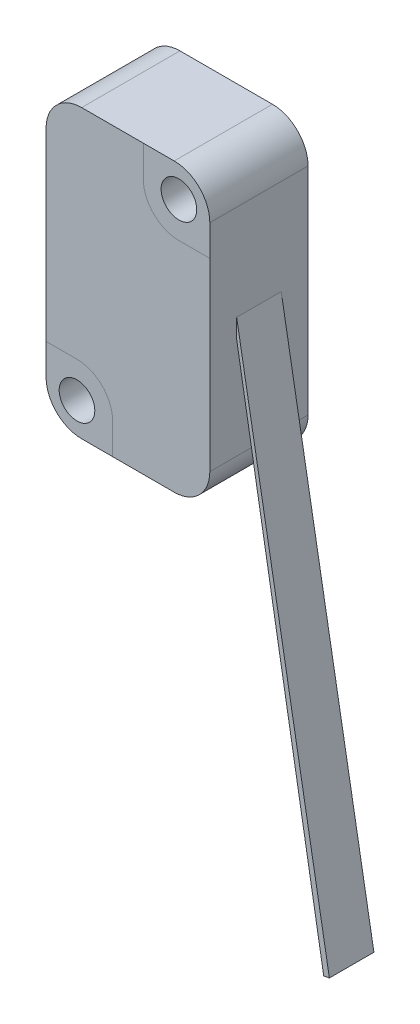
from build123d import *

# Parameters (mm, degrees)
SKETCH1_W                   = 15.875
SKETCH1_H                   = 27.813
BOSS_EXTRUDE1_DEPTH         = 4.7625
BOSS_EXTRUDE2_DEPTH         = 2.159
F_29_0_136_DIAMETER_HOLE1_D = 3.4544
FILLET1_R                   = 3.4544


with BuildPart() as part:
    # Sketch1 → Boss-Extrude1 (new, symmetric)
    with BuildSketch(Plane.XY):
        Rectangle(SKETCH1_W, SKETCH1_H)
    extrude(amount=BOSS_EXTRUDE1_DEPTH, both=True)

    # Sketch2 → Boss-Extrude2 (add, symmetric)
    with BuildSketch(Plane.XY):
        Polygon((7.9375, 1.2065), (16.926432647, -49.772270296), (16.376122074, -49.869304898), (7.9375, -0.655026961), align=None)
    extrude(amount=BOSS_EXTRUDE2_DEPTH, both=True)

    # #29 (0.136) Diameter Hole1 (through all)
    with Locations(Plane.XY.offset(4.7625)):
        with Locations((-4.9403, -10.9093), (4.9403, 10.9093)):
            Hole(F_29_0_136_DIAMETER_HOLE1_D / 2)

    # Fillet1
    fillet1_edges = [part.edges().sort_by_distance(p)[0] for p in [
        (7.9375, -13.9065, 0),
        (-7.9375, -13.9065, 0),
        (7.9375, 13.9065, 0),
        (-7.9375, 13.9065, 0),
    ]]
    fillet(fillet1_edges, radius=FILLET1_R)


solid = part.part
